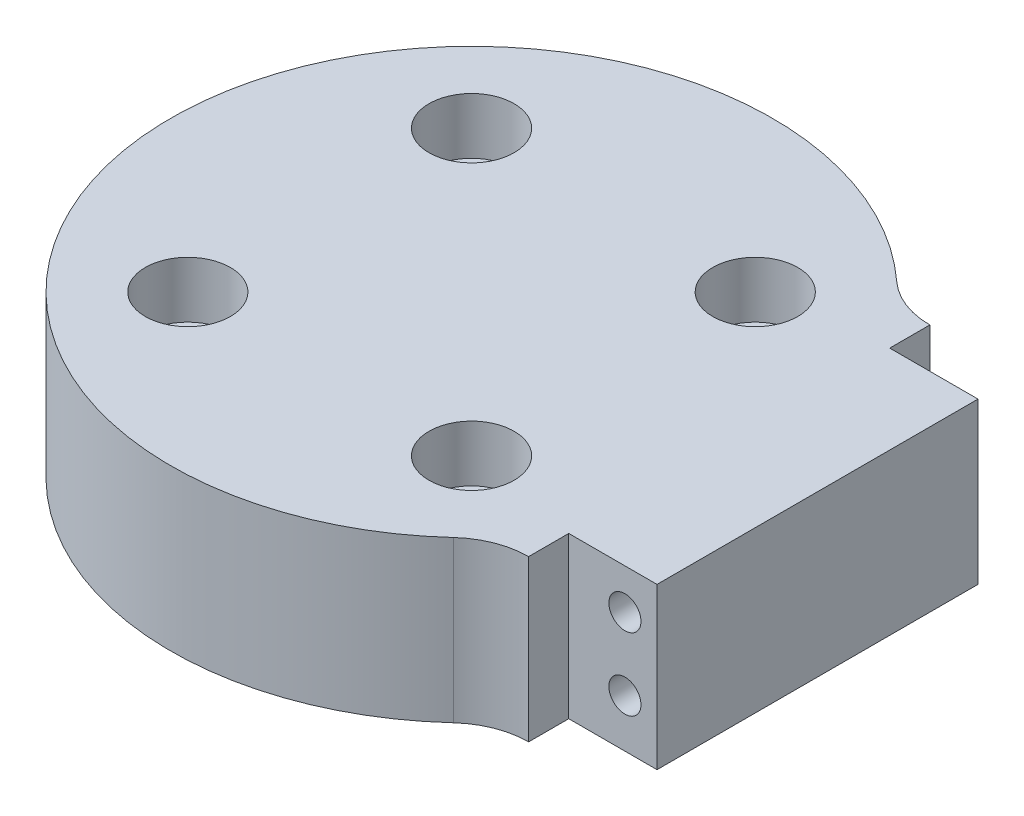
from build123d import *
from build123d.topology import SkipClean

# Parameters (mm, degrees)
SKETCH1_W                = 50
SKETCH1_H                = 50
SKETCH1_RX               = 19.7
SKETCH1_RY               = 19.1
BOSS_EXTRUDE1_DEPTH      = 35
SKETCH2_W                = 30
SKETCH2_H                = 50
CUT_EXTRUDE1_DEPTH       = 35
SKETCH3_W                = 13
SKETCH3_H                = 50
BOSS_EXTRUDE2_DEPTH      = 20
SKETCH4_R                = 1.5
CUT_EXTRUDE2_DEPTH       = 64.639610377
SKETCH5_W                = 36.974567712
SKETCH5_H                = 20
CUT_EXTRUDE3_DEPTH       = 20
BOSS_EXTRUDE3_DEPTH      = 4
BOSS_EXTRUDE3_DEPTH_BACK = 20
SKETCH6_W                = 14
SKETCH6_H                = 20
SKETCH6_R                = 3.25
SKETCH7_R                = 5.3
SKETCH7_R_2              = 3
CUT_EXTRUDE4_DEPTH       = 6
SKETCH8_W                = 13
SKETCH8_H                = 13.025432288
CUT_EXTRUDE5_DEPTH       = 30
FILLET6_R                = 4
FILLET5_R                = 10
SKETCH9_R                = 5.3
BOSS_EXTRUDE4_DEPTH      = 30
SKETCH10_W               = 20
SKETCH10_H               = 50
BOSS_EXTRUDE5_DEPTH      = 45
FILLET7_R                = 10
SKETCH11_W               = 50
SKETCH11_H               = 20
BOSS_EXTRUDE6_DEPTH      = 85
FILLET8_R                = 9.5
SKETCH13_R               = 37.5
BOSS_EXTRUDE7_DEPTH      = 20
CUT_EXTRUDE6_DEPTH       = 85
FILLET9_R                = 10
FILLET10_R               = 10
SKETCH14_R               = 3.25
CUT_EXTRUDE7_DEPTH       = 85
SKETCH15_R               = 5.3
CUT_EXTRUDE8_DEPTH       = 7
SKETCH16_R               = 3.25
BOSS_EXTRUDE9_DEPTH      = 36
SKETCH16_3_R             = 3.25
CUT_EXTRUDE11_DEPTH      = 10
SKETCH18_W               = 78
SKETCH18_H               = 80
CUT_EXTRUDE13_DEPTH      = 69.386919
SKETCH19_W               = 40
SKETCH19_H               = 20
BOSS_EXTRUDE10_DEPTH     = 11
SKETCH20_R               = 2
CUT_EXTRUDE14_DEPTH      = 9
CUT_EXTRUDE15_START      = -9
SKETCH21_R               = 2
CUT_EXTRUDE15_DEPTH      = 9


# Some blends are built 0.0001 mm under size
with BuildPart() as part:
    # Sketch1 → Boss-Extrude1 (new body)
    with BuildSketch(Plane(origin=(0, 0, 0), x_dir=(1, 0, 0), z_dir=(0, 1, 0))):
        Rectangle(SKETCH1_W, SKETCH1_H)
        with Locations((0, 0)):
            Ellipse(SKETCH1_RX, SKETCH1_RY, mode=Mode.SUBTRACT)
    extrude(amount=BOSS_EXTRUDE1_DEPTH)

    # Sketch2 → Cut-Extrude1 (cut)
    with BuildSketch(Plane(origin=(0, 35, 0), x_dir=(1, 0, 0), z_dir=(0, 1, 0))):
        with Locations((10, 0)):
            Rectangle(SKETCH2_W, SKETCH2_H)
    extrude(amount=-CUT_EXTRUDE1_DEPTH, mode=Mode.SUBTRACT)

    # Sketch3 → Boss-Extrude2 (add)
    with BuildSketch(Plane(origin=(0, 35, 0), x_dir=(1, 0, 0), z_dir=(0, 1, 0))):
        with Locations((-18.5, 0)):
            Rectangle(SKETCH3_W, SKETCH3_H)
    extrude(amount=BOSS_EXTRUDE2_DEPTH)

    # Sketch4 → Cut-Extrude2 (cut, through all)
    with BuildSketch(Plane.ZY.offset(25)):
        with Locations((18.474567712, 50)):
            Circle(SKETCH4_R)
    extrude(amount=-CUT_EXTRUDE2_DEPTH, mode=Mode.SUBTRACT)

    # Sketch5 → Cut-Extrude3 (cut)
    with BuildSketch(Plane(origin=(-12, 55, -25), x_dir=(0, 0, 1), z_dir=(-1, 0, 0))):
        with Locations((18.487283856, -10)):
            Rectangle(SKETCH5_W, SKETCH5_H)
    extrude(amount=CUT_EXTRUDE3_DEPTH, mode=Mode.SUBTRACT)

    # Sketch6 → Boss-Extrude3 (add, two sides: drawn at the far end of the back side and taken through both)
    # profile 1 of 2: a face of its own
    with BuildSketch(Plane(origin=(-5, 0, 0), x_dir=(0, 0, -1), z_dir=(1, 0, 0)).offset(-BOSS_EXTRUDE3_DEPTH_BACK)):
        with Locations((-32, 17.5)):
            Rectangle(SKETCH6_W, SKETCH6_H)
        with Locations((-32, 17.5)):
            Circle(SKETCH6_R, mode=Mode.SUBTRACT)
    # profile 2 of 2: a face of its own
    with BuildSketch(Plane(origin=(-5, 0, 0), x_dir=(0, 0, -1), z_dir=(1, 0, 0)).offset(-BOSS_EXTRUDE3_DEPTH_BACK)):
        with Locations((32, 17.5)):
            Rectangle(SKETCH6_W, SKETCH6_H)
        with Locations((32, 17.5)):
            Circle(SKETCH6_R, mode=Mode.SUBTRACT)
    extrude(amount=BOSS_EXTRUDE3_DEPTH + BOSS_EXTRUDE3_DEPTH_BACK)

    # Sketch7 → Cut-Extrude4 (cut)
    with BuildSketch(Plane.ZY.offset(25)):
        with Locations((-32, 17.5)):
            Circle(SKETCH7_R)
        with Locations((32, 17.5)):
            Circle(SKETCH7_R)
        with Locations((18.474567712, 50)):
            Circle(SKETCH7_R_2)
    extrude(amount=-CUT_EXTRUDE4_DEPTH, mode=Mode.SUBTRACT)

    # Sketch8 → Cut-Extrude5 (cut)
    with BuildSketch(Plane(origin=(0, 35, 0), x_dir=(1, 0, 0), z_dir=(0, 1, 0))):
        with Locations((-18.5, -18.487283856)):
            Rectangle(SKETCH8_W, SKETCH8_H)
    extrude(amount=CUT_EXTRUDE5_DEPTH, mode=Mode.SUBTRACT)

    # Fillet6
    fillet6_edges = [part.edges().sort_by_distance(p)[0] for p in [
        (-5, 17.5, 25),
        (-5, 17.5, -25),
    ]]
    fillet(fillet6_edges, radius=FILLET6_R - 0.0001)  # a hair under: the kernel refuses the full size

    # Fillet5
    # the kernel refuses this fillet: 10 mm, written as the material it adds along each edge
    with BuildSketch(Plane(origin=(-5, 7.5, 25), x_dir=(0, -1, 0), z_dir=(-1, 0, 0))) as fillet5_piece_1:
        with BuildLine():
            CenterArc((10, 9.682458366), FILLET5_R, 180, 75.522487814)
            Line((0, 9.682458366), (0, 0))
            Line((0, 0), (7.5, 0))
        make_face()
    extrude(amount=20)
    with BuildSketch(Plane(origin=(-5, 27.5, 25), x_dir=(0, 0, 1), z_dir=(-1, 0, 0)), Plane(origin=(-5, 7.5, -25), x_dir=(0, 0, -1), z_dir=(-1, 0, 0))) as fillet5_piece_2:
        with BuildLine():
            CenterArc((9.682458366, 10), FILLET5_R, 194.477512186, 75.522487814)
            Line((0, 7.5), (0, 0))
            Line((0, 0), (9.682458366, 0))
        make_face()
    extrude(amount=20)
    with BuildSketch(Plane(origin=(-5, 27.5, -25), x_dir=(0, 0, -1), z_dir=(-1, 0, 0))) as fillet5_piece_3:
        with BuildLine():
            CenterArc((9.682458366, -10), FILLET5_R, 90, 75.522487814)
            Line((0, -7.5), (0, 0))
            Line((0, 0), (9.682458366, 0))
        make_face()
    extrude(amount=20)

    # Sketch9 → Boss-Extrude4 (add)
    with BuildSketch(Plane.ZY.offset(25)):
        with BuildLine():
            Line((39, 27.5), (34.682458366, 27.5))
            ThreePointArc((34.682458366, 27.5), (28.558734009, 29.59430585), (25, 35))
            Line((25, 35), (-25, 35))
            ThreePointArc((-25, 35), (-28.558734009, 29.59430585), (-34.682458366, 27.5))
            Line((-34.682458366, 27.5), (-39, 27.5))
            Line((-39, 27.5), (-39, 7.5))
            Line((-39, 7.5), (-34.682458366, 7.5))
            ThreePointArc((-34.682458366, 7.5), (-28.558734009, 5.40569415), (-25, 0))
            Line((-25, 0), (25, 0))
            ThreePointArc((25, 0), (28.558734009, 5.40569415), (34.682458366, 7.5))
            Line((34.682458366, 7.5), (39, 7.5))
            Line((39, 7.5), (39, 27.5))
        make_face()
        with Locations((32, 17.5)):
            Circle(SKETCH9_R, mode=Mode.SUBTRACT)
        with Locations((-32, 17.5)):
            Circle(SKETCH9_R, mode=Mode.SUBTRACT)
    extrude(amount=BOSS_EXTRUDE4_DEPTH)

    # Sketch10 → Boss-Extrude5 (add)
    with SkipClean():  # the faces are left unmerged after this step: merging them gives an invalid solid
        with BuildSketch(Plane(origin=(0, 35, 0), x_dir=(1, 0, 0), z_dir=(0, 1, 0))):
            with Locations((-45, 0)):
                Rectangle(SKETCH10_W, SKETCH10_H)
        extrude(amount=BOSS_EXTRUDE5_DEPTH)

    # Fillet7
    fillet7_edges = [part.edges().sort_by_distance(p)[0] for p in [
        (-35, 35, 0),
    ]]
    fillet(fillet7_edges, radius=FILLET7_R - 0.0001)  # a hair under: the kernel refuses the full size

    # Sketch11 → Boss-Extrude6 (add)
    with BuildSketch(Plane.ZY.offset(55)):
        with Locations((0, 70)):
            Rectangle(SKETCH11_W, SKETCH11_H)
    extrude(amount=BOSS_EXTRUDE6_DEPTH)

    # Fillet8
    fillet8_edges = [part.edges().sort_by_distance(p)[0] for p in [
        (-55, 60, 0),
    ]]
    fillet(fillet8_edges, radius=FILLET8_R)

    # Sketch13 → Boss-Extrude7 (add)
    with BuildSketch(Plane(origin=(0, 80, 0), x_dir=(1, 0, 0), z_dir=(0, 1, 0))):
        with Locations((-102.5, 0)):
            Circle(SKETCH13_R)
    extrude(amount=-BOSS_EXTRUDE7_DEPTH)

    # Sketch13<3> → Cut-Extrude6 (cut)
    with BuildSketch(Plane(origin=(0, 80, 0), x_dir=(1, 0, 0), z_dir=(0, 1, 0))):
        with BuildLine():
            Line((-124.371968295, 30.460909424), (-140, 25))
            Line((-140, 25), (-140, 0))
            ThreePointArc((-140, 0), (-135.865017691, 17.117990375), (-124.371968295, 30.460909424))
        make_face()
        with BuildLine():
            ThreePointArc((-130.450849719, -25), (-137.531463461, -13.380828366), (-140, 0))
            Line((-140, 0), (-140, -25))
            Line((-140, -25), (-130.450849719, -25))
        make_face()
    extrude(amount=-CUT_EXTRUDE6_DEPTH, mode=Mode.SUBTRACT)

    # Fillet9
    fillet9_edges = [part.edges().sort_by_distance(p)[0] for p in [
        (-74.549150281, 70, 25),
        (-74.549150281, 70, -25),
    ]]
    fillet(fillet9_edges, radius=FILLET9_R)

    # Fillet10
    fillet10_edges = [part.edges().sort_by_distance(p)[0] for p in [
        (-35, 80, 0),
    ]]
    fillet(fillet10_edges, radius=FILLET10_R)

    # Sketch14 → Cut-Extrude7 (cut)
    with BuildSketch(Plane(origin=(0, 80, 0), x_dir=(1, 0, 0), z_dir=(0, 1, 0))):
        with Locations(Location((-120.17766953, 17.67766953, 0), (0, 0, 270))):
            Circle(SKETCH14_R)
        with Locations(Location((-120.17766953, -17.67766953, 0), (0, 0, 270))):
            Circle(SKETCH14_R)
        with Locations(Location((-84.82233047, -17.67766953, 0), (0, 0, 270))):
            Circle(SKETCH14_R)
        with Locations(Location((-84.82233047, 17.67766953, 0), (0, 0, 270))):
            Circle(SKETCH14_R)
    extrude(amount=-CUT_EXTRUDE7_DEPTH, mode=Mode.SUBTRACT)

    # Sketch15 → Cut-Extrude8 (cut)
    with BuildSketch(Plane(origin=(0, 80, 0), x_dir=(1, 0, 0), z_dir=(0, 1, 0))):
        with Locations(Location((-120.17766953, 17.67766953, 0), (0, 0, 270))):
            Circle(SKETCH15_R)
        with Locations(Location((-120.17766953, -17.67766953, 0), (0, 0, 270))):
            Circle(SKETCH15_R)
        with Locations(Location((-84.82233047, -17.67766953, 0), (0, 0, 270))):
            Circle(SKETCH15_R)
        with Locations(Location((-84.82233047, 17.67766953, 0), (0, 0, 270))):
            Circle(SKETCH15_R)
    extrude(amount=-CUT_EXTRUDE8_DEPTH, mode=Mode.SUBTRACT)

    # Sketch16 → Boss-Extrude9 (add)
    # profile 1 of 2: a face of its own
    with BuildSketch(Plane.ZY.offset(55)):
        Polygon((-25.937822174, 17.5), (-28.968911087, 22.75), (-35.031088913, 22.75), (-38.062177826, 17.5), (-35.031088913, 12.25), (-28.968911087, 12.25), align=None)
        with Locations(Location((-32, 17.5, 0), (0, 0, 180))):
            Circle(SKETCH16_R, mode=Mode.SUBTRACT)
    # profile 2 of 2: a face of its own
    with BuildSketch(Plane.ZY.offset(55)):
        Polygon((25.937822174, 17.5), (28.968911087, 12.25), (35.031088913, 12.25), (38.062177826, 17.5), (35.031088913, 22.75), (28.968911087, 22.75), align=None)
        with Locations(Location((32, 17.5, 0), (0, 0, 180))):
            Circle(SKETCH16_R, mode=Mode.SUBTRACT)
    extrude(amount=-BOSS_EXTRUDE9_DEPTH)

    # Sketch16<3> → Cut-Extrude11 (cut)
    # profile 1 of 2: a face of its own
    with BuildSketch(Plane.ZY.offset(55)):
        Polygon((-25.937822174, 17.5), (-28.968911087, 22.75), (-35.031088913, 22.75), (-38.062177826, 17.5), (-35.031088913, 12.25), (-28.968911087, 12.25), align=None)
        with Locations(Location((-32, 17.5, 0), (0, 0, 180))):
            Circle(SKETCH16_3_R, mode=Mode.SUBTRACT)
    # profile 2 of 2: a face of its own
    with BuildSketch(Plane.ZY.offset(55)):
        Polygon((25.937822174, 17.5), (28.968911087, 12.25), (35.031088913, 12.25), (38.062177826, 17.5), (35.031088913, 22.75), (28.968911087, 22.75), align=None)
        with Locations(Location((32, 17.5, 0), (0, 0, 180))):
            Circle(SKETCH16_3_R, mode=Mode.SUBTRACT)
    extrude(amount=-CUT_EXTRUDE11_DEPTH, mode=Mode.SUBTRACT)

    # Sketch18 → Cut-Extrude13 (cut)
    with BuildSketch(Plane(origin=(-1, 0, 0), x_dir=(0, 0, -1), z_dir=(1, 0, 0))):
        with Locations((0, 40)):
            Rectangle(SKETCH18_W, SKETCH18_H)
    extrude(amount=-CUT_EXTRUDE13_DEPTH, mode=Mode.SUBTRACT)


with BuildPart() as boss_extrude10_tool:
    # Sketch19 → Boss-Extrude10 (new body)
    with BuildSketch(Plane(origin=(-70.386918553, 0, 0), x_dir=(0, 0, -1), z_dir=(1, 0, 0))):
        with Locations((0, 70)):
            Rectangle(SKETCH19_W, SKETCH19_H)
    extrude(amount=BOSS_EXTRUDE10_DEPTH)


with BuildPart() as part_1:
    add(part.part)


with BuildPart() as part_2:
    # Boss-Extrude10: joined with boss_extrude10_tool
    add(part_1.part.fuse(boss_extrude10_tool.part, tol=0.00001))

    # Sketch20 → Cut-Extrude14 (cut)
    with BuildSketch(Plane.XY.offset(20)):
        with Locations((-63.386918553, 75)):
            Circle(SKETCH20_R)
        with Locations((-63.386918553, 66)):
            Circle(SKETCH20_R)
    extrude(amount=-CUT_EXTRUDE14_DEPTH, mode=Mode.SUBTRACT)

    # Sketch21 → Cut-Extrude15 (cut)
    with BuildSketch(Plane(origin=(0, 0, -20), x_dir=(-1, 0, 0), z_dir=(0, 0, -1)).offset(CUT_EXTRUDE15_START)):
        with Locations(Location((63.386918553, 75, 0), (0, 0, 180))):
            Circle(SKETCH21_R)
        with Locations(Location((63.386918553, 66, 0), (0, 0, 180))):
            Circle(SKETCH21_R)
    extrude(amount=CUT_EXTRUDE15_DEPTH, mode=Mode.SUBTRACT)


solid = part_2.part
